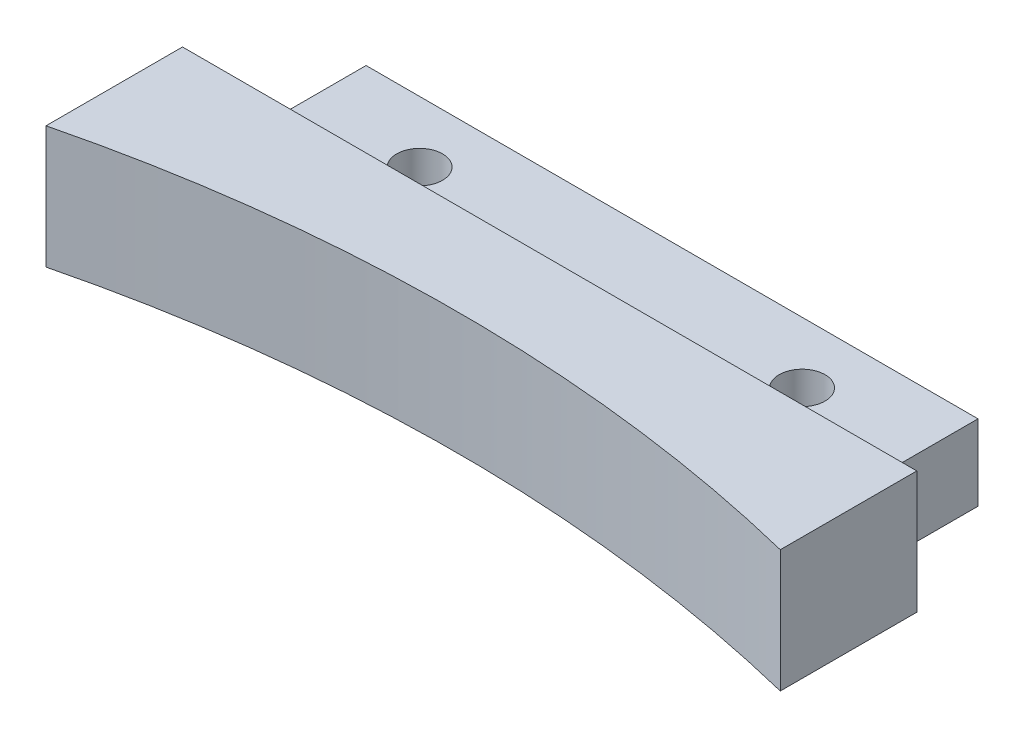
from build123d import *

# Parameters (mm, degrees)
BOSS_EXTRUDE1_DEPTH = 4
SKETCH6_W           = 40
SKETCH6_H           = 8
CUT_EXTRUDE1_DEPTH  = 3.05
SKETCH10_R          = 1.5
CUT_EXTRUDE2_DEPTH  = 30.780541541


with BuildPart() as part:
    # Sketch1 → Boss-Extrude1 (new, symmetric)
    with BuildSketch(Plane(origin=(0, 0, 0), x_dir=(1, 0, 0), z_dir=(0, 1, 0))):
        with BuildLine():
            Line((-20, 0), (0, 0))
            Line((0, 0), (20, 0))
            Line((20, 0), (20, -8))
            Line((20, -8), (24, -8))
            Line((24, -8), (24, -16.922711204))
            ThreePointArc((24, -16.922711204), (0, -14), (-24, -16.922711204))
            Line((-24, -16.922711204), (-24, -8))
            Line((-24, -8), (-20, -8))
            Line((-20, -8), (-20, 0))
        make_face()
    extrude(amount=BOSS_EXTRUDE1_DEPTH, both=True)

    # Sketch6 → Cut-Extrude1 (cut)
    with BuildSketch(Plane(origin=(0, 4, 0), x_dir=(1, 0, 0), z_dir=(0, 1, 0))):
        with Locations((0, -4)):
            Rectangle(SKETCH6_W, SKETCH6_H)
    extrude(amount=-CUT_EXTRUDE1_DEPTH, mode=Mode.SUBTRACT)

    # Sketch10 → Cut-Extrude2 (cut, through all)
    with BuildSketch(Plane(origin=(0, 0.95, 0), x_dir=(1, 0, 0), z_dir=(0, 1, 0))):
        with Locations((-12.5, -4)):
            Circle(SKETCH10_R)
        with Locations((12.5, -4)):
            Circle(SKETCH10_R)
    extrude(amount=-CUT_EXTRUDE2_DEPTH, mode=Mode.SUBTRACT)


solid = part.part
